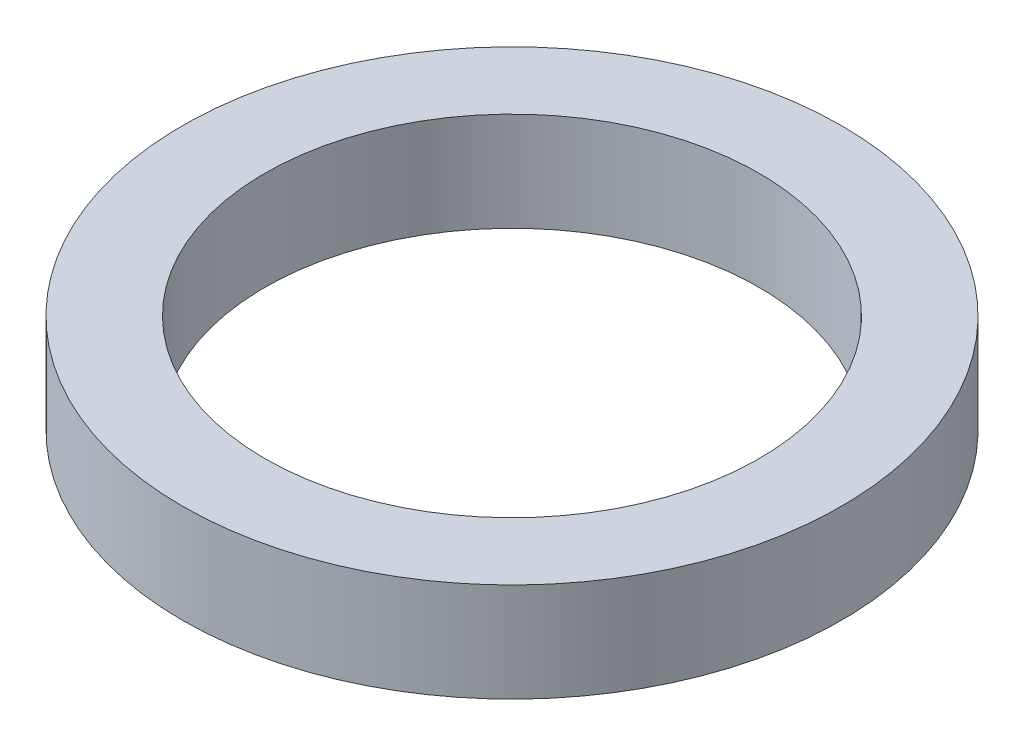
from build123d import *

# Parameters (mm, degrees)
SKETCH1_R           = 60
BOSS_EXTRUDE1_DEPTH = 18
SKETCH2_R           = 45
CUT_EXTRUDE1_DEPTH  = 87.740993769


with BuildPart() as part:
    # Sketch1 → Boss-Extrude1 (new body)
    with BuildSketch(Plane(origin=(0, 0, 0), x_dir=(1, 0, 0), z_dir=(0, 1, 0))):
        Circle(SKETCH1_R)
    extrude(amount=BOSS_EXTRUDE1_DEPTH)

    # Sketch2 → Cut-Extrude1 (cut, through all)
    with BuildSketch(Plane(origin=(0, 0, 0), x_dir=(1, 0, 0), z_dir=(0, 1, 0))):
        Circle(SKETCH2_R)
    extrude(amount=CUT_EXTRUDE1_DEPTH, mode=Mode.SUBTRACT)


solid = part.part
